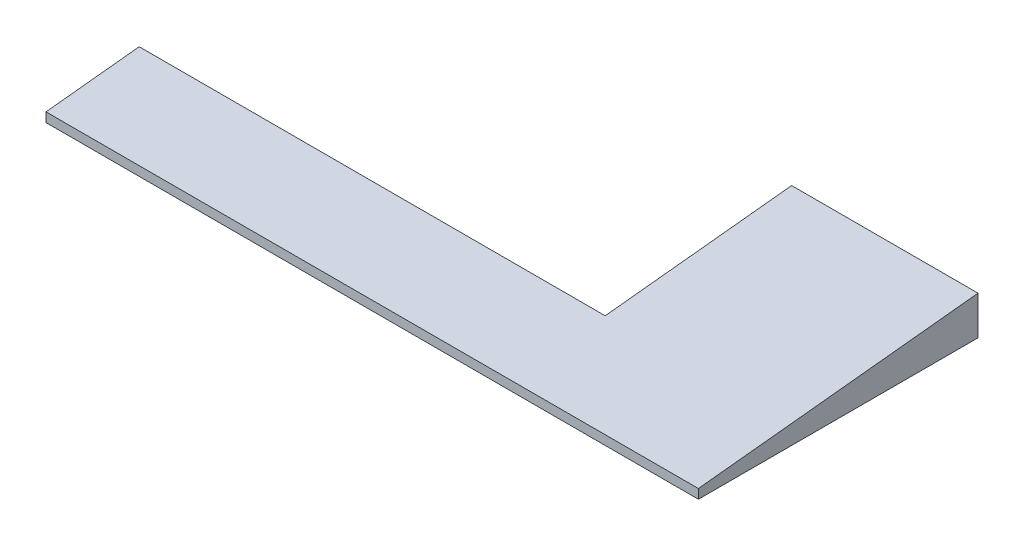
from build123d import *

# Parameters (mm, degrees)
BOSS_EXTRUDE1_DEPTH = 15.24
CHAMFER1_SIZE       = 12.7
CHAMFER1_SIZE_2     = 120.832428569


with BuildPart() as part:
    # Sketch1 → Boss-Extrude1 (new body)
    with BuildSketch(Plane(origin=(0, 0, 0), x_dir=(1, 0, 0), z_dir=(0, 1, 0))):
        Polygon((0, 0), (177.8, 0), (177.8, 76.2), (127, 76.2), (127, 25.4), (0, 25.4), align=None)
    extrude(amount=BOSS_EXTRUDE1_DEPTH)

    # Chamfer1
    # the kernel refuses this chamfer: 120.832428569, 12.7 mm, written as the material it takes off along each edge
    with BuildSketch(Plane(origin=(-314.100660456, 15.24, 0), x_dir=(0, -0.9396808679591153, 0.34205243222582665), z_dir=(1, 0, 0))) as chamfer1_piece_1:
        Polygon((CHAMFER1_SIZE * 0.939680867959, CHAMFER1_SIZE * 0.342052432226), (-CHAMFER1_SIZE_2 * 0.342052432225, CHAMFER1_SIZE_2 * 0.939680867956), (0, 0), align=None)
    extrude(amount=806.001320912, mode=Mode.SUBTRACT)


solid = part.part
